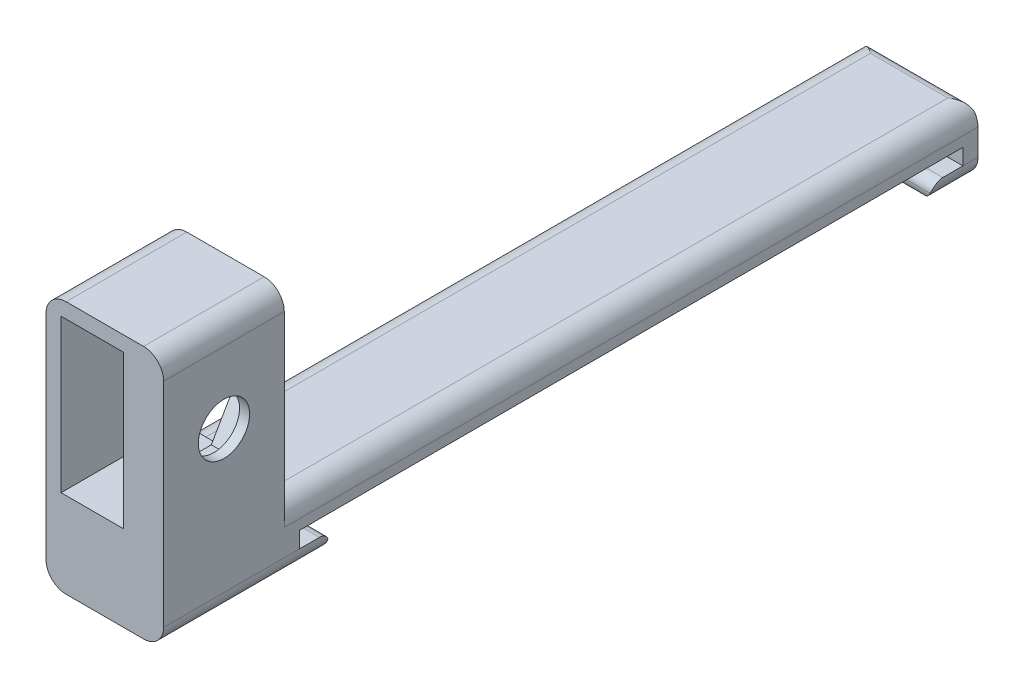
from build123d import *

# Parameters (mm, degrees)
SKETCH1_W           = 11.7
SKETCH1_H           = 18.2
SKETCH1_W_2         = 6.2
SKETCH1_H_2         = 15.2
BOSS_EXTRUDE1_DEPTH = 12
SKETCH4_R           = 2.55
CUT_EXTRUDE1_DEPTH  = 3
SKETCH4_3_R         = 2.55
CUT_EXTRUDE2_DEPTH  = 17.914490829
SKETCH9_W           = 11.7
SKETCH9_H           = 12
BOSS_EXTRUDE4_DEPTH = 7
SKETCH7_W           = 11.7
SKETCH7_H           = 6.6
BOSS_EXTRUDE3_DEPTH = 69
CUT_EXTRUDE4_DEPTH  = 72.812951478
FILLET1_R           = 2
FILLET2_R           = 1


# Some blends are built 0.0001 mm under size
with BuildPart() as part:
    # Sketch1 → Boss-Extrude1 (new body)
    with BuildSketch(Plane.XY):
        with Locations((1.25, 0)):
            Rectangle(SKETCH1_W, SKETCH1_H)
        Rectangle(SKETCH1_W_2, SKETCH1_H_2, mode=Mode.SUBTRACT)
    extrude(amount=BOSS_EXTRUDE1_DEPTH)

    # Sketch4 → Cut-Extrude1 (cut)
    with BuildSketch(Plane.ZY.offset(-3.1)):
        Polygon((0.515172443, 0), (3.257586221, -4.75), (8.742413779, -4.75), (11.484827557, 0), (8.742413779, 4.75), (3.257586221, 4.75), align=None)
        with Locations(Location((6, 0, 0), (0, 0, 270))):
            Circle(SKETCH4_R, mode=Mode.SUBTRACT)
    extrude(amount=-CUT_EXTRUDE1_DEPTH, mode=Mode.SUBTRACT)

    # Sketch4<3> → Cut-Extrude2 (cut, through all)
    with BuildSketch(Plane.ZY.offset(-3.1)):
        with Locations(Location((6, 0, 0), (0, 0, 270))):
            Circle(SKETCH4_3_R)
    extrude(amount=-CUT_EXTRUDE2_DEPTH, mode=Mode.SUBTRACT)

    # Sketch9 → Boss-Extrude4 (add)
    with BuildSketch(Plane.XZ.offset(9.1)):
        with Locations((1.25, 6)):
            Rectangle(SKETCH9_W, SKETCH9_H)
    extrude(amount=BOSS_EXTRUDE4_DEPTH)

    # Sketch7 → Boss-Extrude3 (add)
    with BuildSketch(Plane(origin=(0, -2.9, 0), x_dir=(1, 0, 0), z_dir=(0, 0, -1))):
        with Locations((1.25, 9.9)):
            Rectangle(SKETCH7_W, SKETCH7_H)
    extrude(amount=BOSS_EXTRUDE3_DEPTH)

    # Sketch10 → Cut-Extrude4 (cut, through all)
    with BuildSketch(Plane(origin=(7.1, 0, 0), x_dir=(0, 0, -1), z_dir=(1, 0, 0))):
        Polygon((64.5, -16.1), (64.5, -14.1), (67.5, -14.1), (67.5, -12.5), (1.5, -12.5), (1.5, -14.1), (4.5, -14.1), (4.5, -16.1), align=None)
    extrude(amount=-CUT_EXTRUDE4_DEPTH, mode=Mode.SUBTRACT)

    # Fillet1
    fillet1_edges = [part.edges().sort_by_distance(p)[0] for p in [
        (7.1, 9.1, 6),
        (-4.6, 9.1, 6),
        (-4.6, -16.1, 3.75),
        (7.1, -16.1, 3.75),
        (7.1, -9.5, -34.5),
        (-4.6, -9.5, -34.5),
        (-4.6, -16.1, -66.75),
        (7.1, -16.1, -66.75),
    ]]
    fillet(fillet1_edges, radius=FILLET1_R - 0.0001)  # a hair under: the kernel refuses the full size

    # Fillet2
    # the kernel refuses this fillet: 1 mm, written as the material it takes off along each edge
    with BuildSketch(Plane(origin=(9.6, -14.1, -4.5), x_dir=(0, -1, 0), z_dir=(-1, 0, 0)), Plane(origin=(9.6, -14.1, -64.5), x_dir=(0, 0, -1), z_dir=(-1, 0, 0))) as fillet2_piece_1:
        with BuildLine():
            CenterArc((FILLET2_R, FILLET2_R), FILLET2_R, 180, 90)
            Line((0, FILLET2_R), (0, 0))
            Line((0, 0), (FILLET2_R, 0))
        make_face()
    extrude(amount=16.7, mode=Mode.SUBTRACT)
    with BuildSketch(Plane(origin=(7.6001, -16.1, -4.5), x_dir=(0, 0, 1), z_dir=(-1, 0, 0)), Plane(origin=(7.6001, -9.5, -69), x_dir=(0, -1, 0), z_dir=(-1, 0, 0)), Plane(origin=(-5.1001, -16.1, -69), x_dir=(0, 1, 0), z_dir=(1, 0, 0)), Plane(origin=(7.6001, -16.1, -64.5), x_dir=(0, 1, 0), z_dir=(-1, 0, 0))) as fillet2_piece_2:
        with BuildLine():
            CenterArc((FILLET2_R, FILLET2_R), FILLET2_R, 180, 90)
            Line((0, FILLET2_R), (0, 0))
            Line((0, 0), (FILLET2_R, 0))
        make_face()
    extrude(amount=12.7002, mode=Mode.SUBTRACT)


solid = part.part
